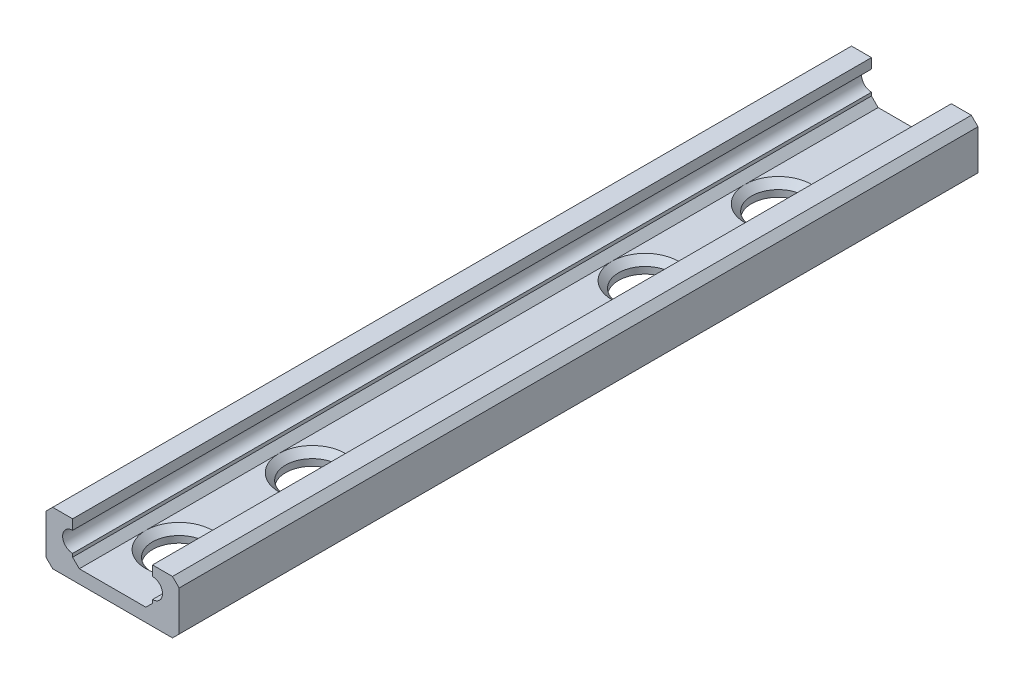
from build123d import *

# Parameters (mm, degrees)
BOSS_EXTRUDE1_DEPTH        = 100
CHAMFER1_SIZE              = 0.5
SKETCH5_R                  = 2
CUT_EXTRUDE1_DEPTH         = 200
CHAMFER2_SIZE              = 0.5
LPATTERN1_COUNT            = 3
LPATTERN1_PITCH            = 35
CHAMFER2_OF_LPATTERN1_SIZE = 0.5
CUT_EXTRUDE2_DEPTH         = 10
CUT_EXTRUDE2_DEPTH_BACK    = 10
SKETCH6_W                  = 15
SKETCH6_H                  = 40


with BuildPart() as part:
    # Sketch1 → Boss-Extrude1 (new body)
    with BuildSketch(Plane.XY):
        with BuildLine():
            Line((-3, 2), (-5, 2))
            Line((-5, 2), (-5, -2))
            Line((-5, -2), (5, -2))
            Line((5, -2), (5, 2))
            Line((5, 2), (3, 2))
            Line((3, 2), (3, 1.25))
            ThreePointArc((3, 1.25), (3.530330086, 1.030330086), (3.75, 0.5))
            ThreePointArc((3.75, 0.5), (3.530330086, -0.030330086), (3, -0.25))
            Line((3, -0.25), (3, -1))
            Line((3, -1), (-3, -1))
            Line((-3, -1), (-3, -0.25))
            ThreePointArc((-3, -0.25), (-3.75, 0.5), (-3, 1.25))
            Line((-3, 1.25), (-3, 2))
        make_face()
    extrude(amount=BOSS_EXTRUDE1_DEPTH)

    # Chamfer1
    chamfer1_edges = [part.edges().sort_by_distance(p)[0] for p in [
        (-3, -1, 50),
        (3, -1, 50),
        (5, 2, 50),
        (5, -2, 50),
        (-5, -2, 50),
        (-5, 2, 50),
    ]]
    chamfer(chamfer1_edges, length=CHAMFER1_SIZE)

    # Sketch5 → Cut-Extrude1 (cut)
    with BuildSketch(Plane(origin=(0, -1, 0), x_dir=(1, 0, 0), z_dir=(0, 1, 0))):
        with Locations(Location((0, -10, 0), (0, 0, 270))):
            Circle(SKETCH5_R)
        with Locations(Location((0, -20, 0), (0, 0, 270))):
            Circle(SKETCH5_R)
    cut_extrude1 = extrude(amount=-CUT_EXTRUDE1_DEPTH, mode=Mode.SUBTRACT)

    # Chamfer2
    chamfer2_edges = [part.edges().sort_by_distance(p)[0] for p in [
        (0, -1, 8),
        (0, -1, 18),
    ]]
    chamfer(chamfer2_edges, length=CHAMFER2_SIZE - 0.0001)  # a hair under: the kernel refuses the full size

    # LPattern1: Cut-Extrude1 ×3
    with Locations(*[(0, 0, i * LPATTERN1_PITCH) for i in range(1, LPATTERN1_COUNT)]):
        add(cut_extrude1, mode=Mode.SUBTRACT)

    # Chamfer2 of LPattern1
    chamfer2_of_lpattern1_edges = [part.edges().sort_by_distance(p)[0] for p in [
        (0, -1, 43),
        (0, -1, 53),
        (0, -1, 78),
        (0, -1, 88),
    ]]
    chamfer(chamfer2_of_lpattern1_edges, length=CHAMFER2_OF_LPATTERN1_SIZE - 0.0001)  # a hair under: the kernel refuses the full size

    # Sketch6 → Cut-Extrude2 (cut, two sides: drawn at the far end of the back side and taken through both)
    with BuildSketch(Plane(origin=(0, 0, 0), x_dir=(1, 0, 0), z_dir=(0, 1, 0)).offset(-CUT_EXTRUDE2_DEPTH_BACK)):
        with Locations((0, -80)):
            Rectangle(SKETCH6_W, SKETCH6_H)
    extrude(amount=CUT_EXTRUDE2_DEPTH + CUT_EXTRUDE2_DEPTH_BACK, mode=Mode.SUBTRACT)


solid = part.part
